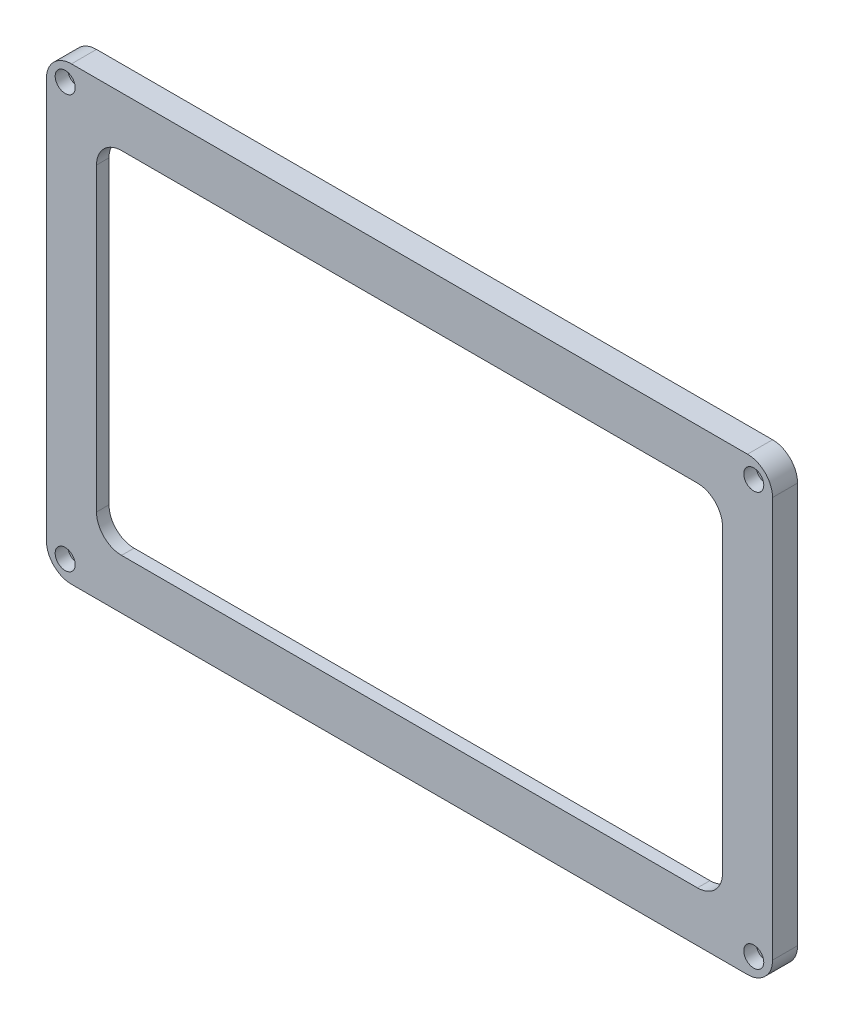
from build123d import *

# Parameters (mm, degrees)
SKETCH_1_W          = 58
SKETCH_1_H          = 36
EXTRUDE_1_DEPTH     = 3
SKETCH_2_W          = 52.5
SKETCH_2_H          = 30.5
CUT_EXTRUDE_1_DEPTH = 2
SKETCH_3_W          = 50
SKETCH_3_H          = 28
CUT_EXTRUDE_2_DEPTH = 2
FILLET_1_R          = 2
SKETCH_4_W          = 58
SKETCH_4_H          = 36
CUT_EXTRUDE_3_DEPTH = 1
FILLET_2_R          = 0.2
SKETCH_5_R          = 0.8
CUT_EXTRUDE_4_DEPTH = 1
SKETCH_6_R          = 0.6
CUT_EXTRUDE_5_DEPTH = 20.5


with BuildPart() as part:
    # 草图1 → 凸台-拉伸1 (new body)
    with BuildSketch(Plane.XY):
        Rectangle(SKETCH_1_W, SKETCH_1_H)
    extrude(amount=EXTRUDE_1_DEPTH)

    # 草图2 → 切除-拉伸1 (cut)
    with BuildSketch(Plane(origin=(0, 0, 0), x_dir=(-1, 0, 0), z_dir=(0, 0, -1))):
        Rectangle(SKETCH_2_W, SKETCH_2_H)
    extrude(amount=-CUT_EXTRUDE_1_DEPTH, mode=Mode.SUBTRACT)

    # 草图3 → 切除-拉伸2 (cut)
    with BuildSketch(Plane.XY.offset(3)):
        Rectangle(SKETCH_3_W, SKETCH_3_H)
    extrude(amount=-CUT_EXTRUDE_2_DEPTH, mode=Mode.SUBTRACT)

    # 圆角1
    fillet_1_edges = [part.edges().sort_by_distance(p)[0] for p in [
        (-25, -14, 2.5),
        (25, -14, 2.5),
        (25, 14, 2.5),
        (-25, 14, 2.5),
        (-29, 18, 1.5),
        (29, 18, 1.5),
        (29, -18, 1.5),
        (-29, -18, 1.5),
    ]]
    fillet(fillet_1_edges, radius=FILLET_1_R)

    # 草图4 → 切除-拉伸3 (cut)
    with BuildSketch(Plane(origin=(0, 0, 0), x_dir=(-1, 0, 0), z_dir=(0, 0, -1))):
        Rectangle(SKETCH_4_W, SKETCH_4_H)
    extrude(amount=-CUT_EXTRUDE_3_DEPTH, mode=Mode.SUBTRACT)

    # 圆角2
    fillet_2_edges = [part.edges().sort_by_distance(p)[0] for p in [
        (26.25, 15.25, 1.5),
        (-26.25, 15.25, 1.5),
        (-26.25, -15.25, 1.5),
        (26.25, -15.25, 1.5),
    ]]
    fillet(fillet_2_edges, radius=FILLET_2_R)

    # 草图5 → 切除-拉伸4 (cut)
    with BuildSketch(Plane.XY.offset(3)):
        with Locations((-27.5, 16.5)):
            Circle(SKETCH_5_R)
        with Locations((27.5, 16.5)):
            Circle(SKETCH_5_R)
        with Locations((27.5, -16.5)):
            Circle(SKETCH_5_R)
        with Locations((-27.5, -16.5)):
            Circle(SKETCH_5_R)
    extrude(amount=-CUT_EXTRUDE_4_DEPTH, mode=Mode.SUBTRACT)

    # 草图6 → 切除-拉伸5 (cut)
    with BuildSketch(Plane.XY.offset(2)):
        with Locations((-27.5, 16.5)):
            Circle(SKETCH_6_R)
        with Locations((27.5, 16.5)):
            Circle(SKETCH_6_R)
        with Locations((27.5, -16.5)):
            Circle(SKETCH_6_R)
        with Locations((-27.5, -16.5)):
            Circle(SKETCH_6_R)
    extrude(amount=-CUT_EXTRUDE_5_DEPTH, mode=Mode.SUBTRACT)


solid = part.part
